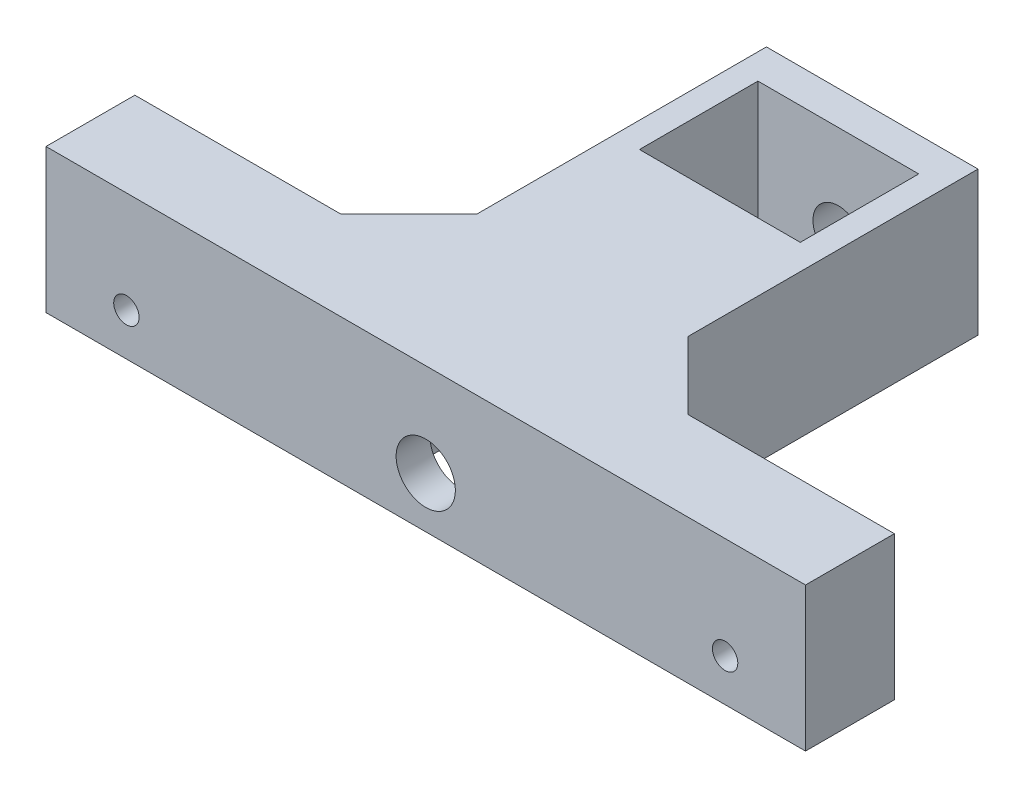
from build123d import *

# Parameters (mm, degrees)
SKETCH_1_W          = 19
SKETCH_1_H          = 14
EXTRUDE_1_DEPTH     = 12
CUT_EXTRUDE_2_REACH = 72.284
SKETCH_4_R          = 1.5
SKETCH_5_W          = 19
SKETCH_5_H          = 14
EXTRUDE_2_DEPTH     = 5
CUT_EXTRUDE_4_REACH = 73.308
SKETCH_6_R          = 3
SKETCH_7_R          = 3.5
CUT_EXTRUDE_5_DEPTH = 4
CHAMFER_1_SIZE      = 4
CHAMFER_2_SIZE      = 8


with BuildPart() as part:
    # 草图1 → 凸台-拉伸1 (new body)
    with BuildSketch(Plane(origin=(0, 0, 0), x_dir=(1, 0, 0), z_dir=(0, 1, 0))):
        Polygon((-30.87, 10.5), (-12.5, 10.5), (-12.5, 52.75), (12.5, 52.75), (12.5, 10.5), (30.87, 10.5), (30.87, 4), (39.87, 4), (39.87, 10.5), (44.87, 10.5), (44.87, 0), (-44.87, 0), (-44.87, 10.5), (-39.87, 10.5), (-39.87, 4), (-30.87, 4), align=None)
        with Locations((0, 41.75)):
            Rectangle(SKETCH_1_W, SKETCH_1_H, mode=Mode.SUBTRACT)
        Polygon((-7.5, 31.75), (7.5, 31.75), (7.5, 7.5), (7.5, 4), (-7.5, 4), (-7.5, 7.5), align=None, mode=Mode.SUBTRACT)
    extrude(amount=EXTRUDE_1_DEPTH)

    # 草图4 → 切除-拉伸2 (cut, up to next)
    with BuildSketch(Plane.XY, mode=Mode.PRIVATE) as cut_extrude_2_sk1:
        with Locations((-35.37, 5)):
            Circle(SKETCH_4_R)
    cut_extrude_2_tool1 = extrude(cut_extrude_2_sk1.sketch, amount=-CUT_EXTRUDE_2_REACH, mode=Mode.PRIVATE) & part.part
    # 草图4 → 切除-拉伸2 (cut, up to next)
    with BuildSketch(Plane.XY, mode=Mode.PRIVATE) as cut_extrude_2_sk2:
        with Locations((35.37, 5)):
            Circle(SKETCH_4_R)
    cut_extrude_2_tool2 = extrude(cut_extrude_2_sk2.sketch, amount=-CUT_EXTRUDE_2_REACH, mode=Mode.PRIVATE) & part.part
    add(cut_extrude_2_tool1.solids().sort_by_distance((-35.37, 5, 0))[0], mode=Mode.SUBTRACT)
    add(cut_extrude_2_tool2.solids().sort_by_distance((35.37, 5, 0))[0], mode=Mode.SUBTRACT)

    # 草图5 → 凸台-拉伸2 (add)
    with BuildSketch(Plane(origin=(0, 12, 0), x_dir=(1, 0, 0), z_dir=(0, 1, 0))):
        Polygon((-39.87, 10.5), (-30.87, 10.5), (-12.5, 10.5), (-12.5, 52.75), (12.5, 52.75), (12.5, 10.5), (30.87, 10.5), (39.87, 10.5), (44.87, 10.5), (44.87, 0), (-44.87, 0), (-44.87, 10.5), align=None)
        with Locations((0, 41.75)):
            Rectangle(SKETCH_5_W, SKETCH_5_H, mode=Mode.SUBTRACT)
    extrude(amount=EXTRUDE_2_DEPTH)

    # 切除-拉伸4: up to this face of the body (flat: up to its plane)
    cut_extrude_4_end = Plane(part.part.faces().sort_by_distance((0, 6, -31.75))[0])
    # 草图6 → 切除-拉伸4 (cut, up to the picked face)
    with BuildSketch(Plane(origin=(0, 0, -52.75), x_dir=(-1, 0, 0), z_dir=(0, 0, -1)), mode=Mode.PRIVATE) as cut_extrude_4_sk1:
        with Locations((0, 6)):
            Circle(SKETCH_6_R)
    cut_extrude_4_tool1 = split(extrude(cut_extrude_4_sk1.sketch, amount=-CUT_EXTRUDE_4_REACH, mode=Mode.PRIVATE), bisect_by=cut_extrude_4_end, keep=Keep.BOTH, mode=Mode.PRIVATE)
    add(cut_extrude_4_tool1.solids().sort_by(Axis((0, 6, -52.75), (0, 0, 1)))[0], mode=Mode.SUBTRACT)

    # 草图7 → 切除-拉伸5 (cut)
    with BuildSketch(Plane.XY):
        with Locations((0, 6)):
            Circle(SKETCH_7_R)
    extrude(amount=-CUT_EXTRUDE_5_DEPTH, mode=Mode.SUBTRACT)

    # 倒角1
    chamfer_1_edges = [part.edges().sort_by_distance(p)[0] for p in [
        (-7.5, 6, -4),
        (7.5, 6, -4),
        (7.5, 6, -31.75),
        (-7.5, 6, -31.75),
    ]]
    chamfer(chamfer_1_edges, length=CHAMFER_1_SIZE - 0.0001)  # a hair under: the kernel refuses the full size

    # 倒角2
    chamfer_2_edges = [part.edges().sort_by_distance(p)[0] for p in [
        (-12.5, 8.5, -10.5),
        (12.5, 8.5, -10.5),
    ]]
    chamfer(chamfer_2_edges, length=CHAMFER_2_SIZE)


solid = part.part
